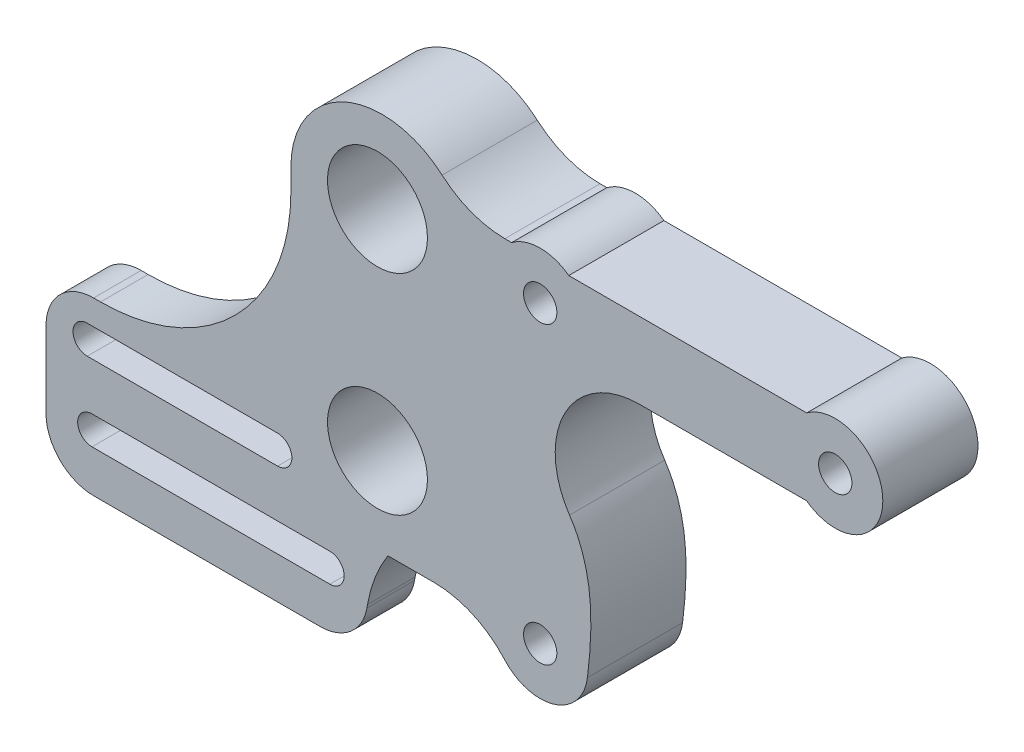
from build123d import *

# Parameters (mm, degrees)
SKETCH1_R           = 1.75
SKETCH1_R_2         = 5.25
BOSS_EXTRUDE1_DEPTH = 10
EXTRUDE1_DEPTH      = 5
FILLET2_R           = 20
FILLET3_R           = 5
FILLET5_R           = 5
EXTRUDE2_DEPTH      = 5
FILLET7_R           = 475
FILLET8_R           = 15
FILLET9_R           = 5
SKETCH4_R           = 3.5
EXTRUDE3_DEPTH      = 2


with BuildPart() as part:
    # Sketch1 → Boss-Extrude1 (new body)
    with BuildSketch(Plane.XY):
        with BuildLine():
            Line((59.115327383, 43.551262968), (59.822811009, 43.551262968))
            ThreePointArc((59.822811009, 43.551262968), (62.822811009, 44.551262968), (65.822811009, 43.551262968))
            Line((65.822811009, 43.551262968), (90.822811009, 43.551262968))
            ThreePointArc((90.822811009, 43.551262968), (98.822811009, 39.551262968), (90.822811009, 35.551262968))
            Line((90.822811009, 35.551262968), (73.221068218, 35.551262968))
            ThreePointArc((73.221068218, 35.551262968), (65.430500205, 30.870379763), (65.905746743, 21.794160382))
            add(Edge.make_bspline(
                [(65.905746743, 21.794160382), (68.510586107, 17.931817085), (68.397648351, 12.955422289), (67.785956814, 7.945306105)],
                knots=[0, 0, 0, 0, 1, 1, 1, 1], degree=3))
            ThreePointArc((67.785956814, 7.945306105), (67.117243875, 5.990433735), (65.715264602, 4.47281814))
            ThreePointArc((65.715264602, 4.47281814), (62.263505272, 3.582643734), (59.096031047, 5.217929635))
            ThreePointArc((59.096031047, 5.217929635), (55.724954026, 7.67997226), (51.642471122, 8.551262968))
            Line((51.642471122, 8.551262968), (46.826949913, 8.551262968))
            ThreePointArc((46.826949913, 8.551262968), (39.614460745, 11.5387738), (36.626949913, 18.751262968))
            Line((36.626949913, 18.751262968), (36.626949913, 38.848632096))
            ThreePointArc((36.626949913, 38.848632096), (42.251881835, 47.568318218), (52.515088487, 46.03881686))
            ThreePointArc((52.515088487, 46.03881686), (55.588605185, 44.19379373), (59.115327383, 43.551262968))
        make_face()
        with Locations((93.822811009, 39.551262968)):
            Circle(SKETCH1_R, mode=Mode.SUBTRACT)
        with Locations((62.822811009, 39.551262968)):
            Circle(SKETCH1_R, mode=Mode.SUBTRACT)
        with Locations((62.822811009, 8.551262968)):
            Circle(SKETCH1_R, mode=Mode.SUBTRACT)
        with Locations((45.725055781, 39.551262968)):
            Circle(SKETCH1_R_2, mode=Mode.SUBTRACT)
        with Locations((45.725055781, 17.551264875)):
            Circle(SKETCH1_R_2, mode=Mode.SUBTRACT)
    extrude(amount=-BOSS_EXTRUDE1_DEPTH)

    # Sketch2 → Extrude1 (add)
    with BuildSketch(Plane.XY):
        Polygon((45.636633265, 8.551262968), (43.896905309, -1.448737032), (10.896905309, -1.448737032), (10.896905309, 16.551262968), (37.366610934, 16.551262968), (39.363957543, 12.249932276), (45.636633265, 10.857586925), align=None)
    extrude(amount=-EXTRUDE1_DEPTH)

    # Fillet2
    # the kernel refuses this fillet: 20 mm, written as the material it adds along each edge
    with BuildSketch(Plane(origin=(36.867030235, 16.551262968, -5), x_dir=(-0.0120031513061412, 0.9999279595844501, 0), z_dir=(0, 0, 1))) as fillet2_piece_1:
        with BuildLine():
            CenterArc((20.241503938, 19.998559192), FILLET2_R, 179.312253574, 90)
            Line((0.242944747, 20.238622218), (-1.756911173, 20.26262852))
            Line((-1.756911173, 20.26262852), (-1.999855919, 0.024006303))
            Line((-1.999855919, 0.024006303), (0.407900213, -1.957962568))
            ThreePointArc((0.407900213, -1.957962568), (2.178716929, -1.786199826), (19.97743461, -1.999855919))
            Line((19.97743461, -1.999855919), (20.001440912, 0))
        make_face()
    extrude(amount=5)

    # Fillet3
    fillet3_edges = [part.edges().sort_by_distance(p)[0] for p in [
        (10.896905309, 16.551262968, -2.5),
    ]]
    fillet(fillet3_edges, radius=FILLET3_R)

    # Fillet5
    fillet5_edges = [part.edges().sort_by_distance(p)[0] for p in [
        (10.896905309, -1.448737032, -2.5),
    ]]
    fillet(fillet5_edges, radius=FILLET5_R)

    # Sketch3 → Extrude2 (cut)
    with BuildSketch(Plane(origin=(0, 0, -5), x_dir=(-1, 0, 0), z_dir=(0, 0, -1))):
        with BuildLine():
            Line((-15.230767467, 10.918134064), (-35.230767467, 10.918134064))
            ThreePointArc((-35.230767467, 10.918134064), (-36.730767467, 12.418134064), (-35.230767467, 13.918134064))
            Line((-35.230767467, 13.918134064), (-15.230767467, 13.918134064))
            ThreePointArc((-15.230767467, 13.918134064), (-13.730767467, 12.418134064), (-15.230767467, 10.918134064))
        make_face()
        with BuildLine():
            Line((-15.725055781, 2.918134064), (-40.725055781, 2.918134064))
            ThreePointArc((-40.725055781, 2.918134064), (-42.225055781, 4.418134064), (-40.725055781, 5.918134064))
            Line((-40.725055781, 5.918134064), (-15.725055781, 5.918134064))
            ThreePointArc((-15.725055781, 5.918134064), (-14.225055781, 4.418134064), (-15.725055781, 2.918134064))
        make_face()
    extrude(amount=-EXTRUDE2_DEPTH, mode=Mode.SUBTRACT)

    # Fillet7
    # the kernel refuses this fillet: 475 mm, written as the material it adds along each edge
    with BuildSketch(Plane(origin=(45.636633265, 8.620954667, -5), x_dir=(0, -1, 0), z_dir=(0, 0, 1))) as fillet7_piece_1:
        with BuildLine():
            CenterArc((475.069322793, 0.591997114), FILLET7_R, 179.929346264, 0.142062041)
            ThreePointArc((0.069683944, 1.17773862), (0.051884348, 0.587860954), (0, 0))
            Line((0, 0), (0.069691699, 0))
        make_face()
    extrude(amount=5)

    # Fillet8
    # the kernel refuses this fillet: 15 mm, written as the material it adds along each edge
    with BuildSketch(Plane(origin=(45.636633265, 8.551262968, 0), x_dir=(0.9999999999783198, 6.584854434625016e-06, 0), z_dir=(0, 0, -1))) as fillet8_piece_1:
        with BuildLine():
            CenterArc((13.821083543, 8.071296621), FILLET8_R, 189.869507231, 22.683962159)
            Line((-0.956926764, 5.500224598), (0, 0))
            ThreePointArc((0, 0), (0.58886931, -0.000365018), (1.17773862, 0))
        make_face()
    extrude(amount=5)

    # Fillet9
    fillet9_edges = [part.edges().sort_by_distance(p)[0] for p in [
        (43.896905309, -1.448737032, -2.5),
    ]]
    fillet(fillet9_edges, radius=FILLET9_R)

    # Sketch4 → Extrude3 (cut)
    with BuildSketch(Plane(origin=(0, 0, -10), x_dir=(-1, 0, 0), z_dir=(0, 0, -1))):
        with Locations((-62.822811009, 39.551262968)):
            Circle(SKETCH4_R)
        with Locations((-93.822811009, 39.551262968)):
            Circle(SKETCH4_R)
        with Locations((-62.822811009, 8.551262968)):
            Circle(SKETCH4_R)
    extrude(amount=-EXTRUDE3_DEPTH, mode=Mode.SUBTRACT)


solid = part.part
